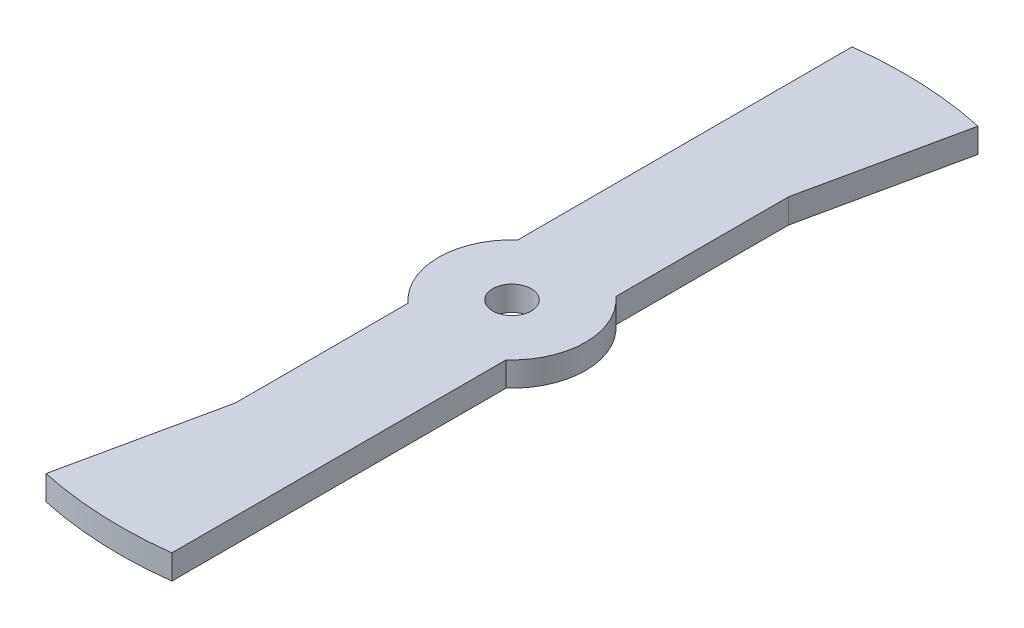
from build123d import *

# Parameters (mm, degrees)
BOSS_EXTRUDE1_DEPTH = 6.35
SKETCH2_R           = 5
CUT_EXTRUDE1_DEPTH  = 9.144


with BuildPart() as part:
    # Sketch1 → Boss-Extrude1 (new body)
    with BuildSketch(Plane(origin=(0, 0, 0), x_dir=(1, 0, 0), z_dir=(0, 1, 0))):
        with BuildLine():
            ThreePointArc((21.389473684, 99.322960163), (4.407318933, 101.504362171), (-12.7, 100.803124952))
            Line((-12.7, 100.803124952), (-12.7, 14.199031657))
            ThreePointArc((-12.7, 14.199031657), (-19.05, 0), (-12.7, -14.199031657))
            Line((-12.7, -14.199031657), (-12.7, -58.973007597))
            Line((-12.7, -58.973007597), (-21.389473684, -99.322960163))
            ThreePointArc((-21.389473684, -99.322960163), (-4.407318933, -101.504362171), (12.7, -100.803124952))
            Line((12.7, -100.803124952), (12.7, -14.199031657))
            ThreePointArc((12.7, -14.199031657), (19.05, 0), (12.7, 14.199031657))
            Line((12.7, 14.199031657), (12.7, 58.973007597))
            Line((12.7, 58.973007597), (21.389473684, 99.322960163))
        make_face()
    extrude(amount=BOSS_EXTRUDE1_DEPTH)

    # Sketch2 → Cut-Extrude1 (cut)
    with BuildSketch(Plane(origin=(0, 6.35, 0), x_dir=(1, 0, 0), z_dir=(0, 1, 0))):
        Circle(SKETCH2_R)
    extrude(amount=-CUT_EXTRUDE1_DEPTH, mode=Mode.SUBTRACT)


solid = part.part
